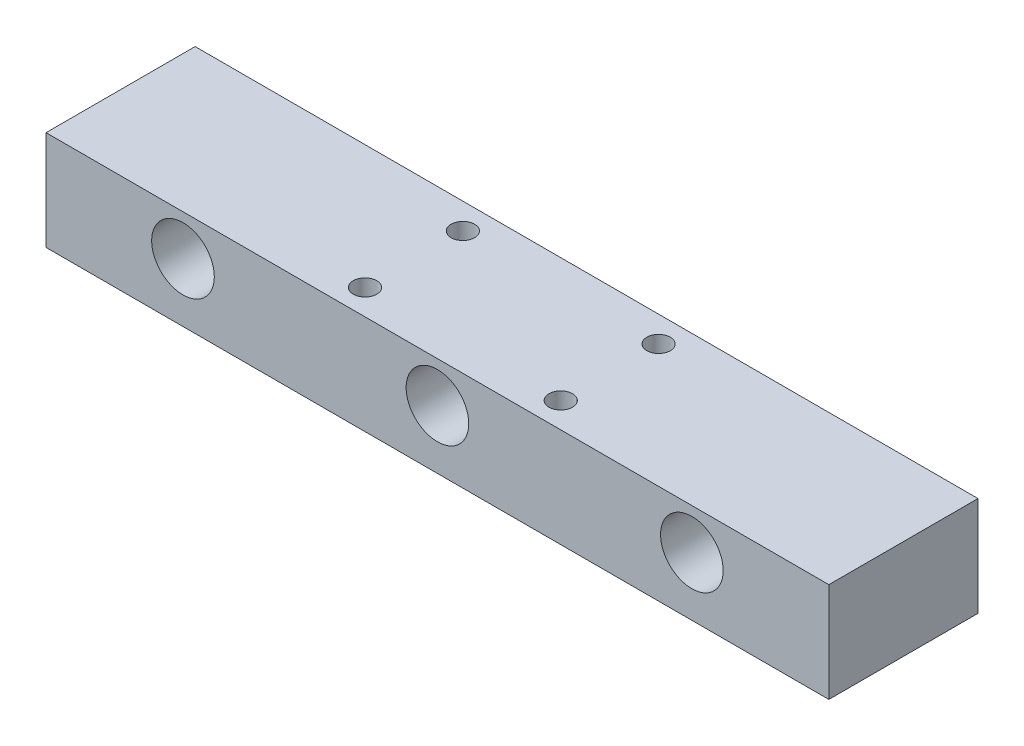
from build123d import *

# Parameters (mm, degrees)
SKETCH1_W           = 400
SKETCH1_H           = 76.2
BOSS_EXTRUDE1_DEPTH = 50.8
SKETCH3_R           = 6
CUT_EXTRUDE2_DEPTH  = 50.8
SKETCH5_R           = 16
CUT_EXTRUDE3_DEPTH  = 411.349948215


with BuildPart() as part:
    # Sketch1 → Boss-Extrude1 (new body)
    with BuildSketch(Plane(origin=(0, 0, 0), x_dir=(1, 0, 0), z_dir=(0, 1, 0))):
        with Locations((200, 38.1)):
            Rectangle(SKETCH1_W, SKETCH1_H)
    extrude(amount=BOSS_EXTRUDE1_DEPTH)

    # Sketch3 → Cut-Extrude2 (cut)
    with BuildSketch(Plane(origin=(0, 50.8, 0), x_dir=(1, 0, 0), z_dir=(0, 1, 0))):
        with Locations((150, 63)):
            Circle(SKETCH3_R)
        with Locations((150, 13)):
            Circle(SKETCH3_R)
        with Locations((250, 63)):
            Circle(SKETCH3_R)
        with Locations((250, 13)):
            Circle(SKETCH3_R)
    extrude(amount=-CUT_EXTRUDE2_DEPTH, mode=Mode.SUBTRACT)

    # Sketch5 → Cut-Extrude3 (cut, through all)
    with BuildSketch(Plane.XY):
        with Locations((200, 30)):
            Circle(SKETCH5_R)
        with Locations((330, 30)):
            Circle(SKETCH5_R)
        with Locations((70, 30)):
            Circle(SKETCH5_R)
    extrude(amount=-CUT_EXTRUDE3_DEPTH, mode=Mode.SUBTRACT)


solid = part.part
